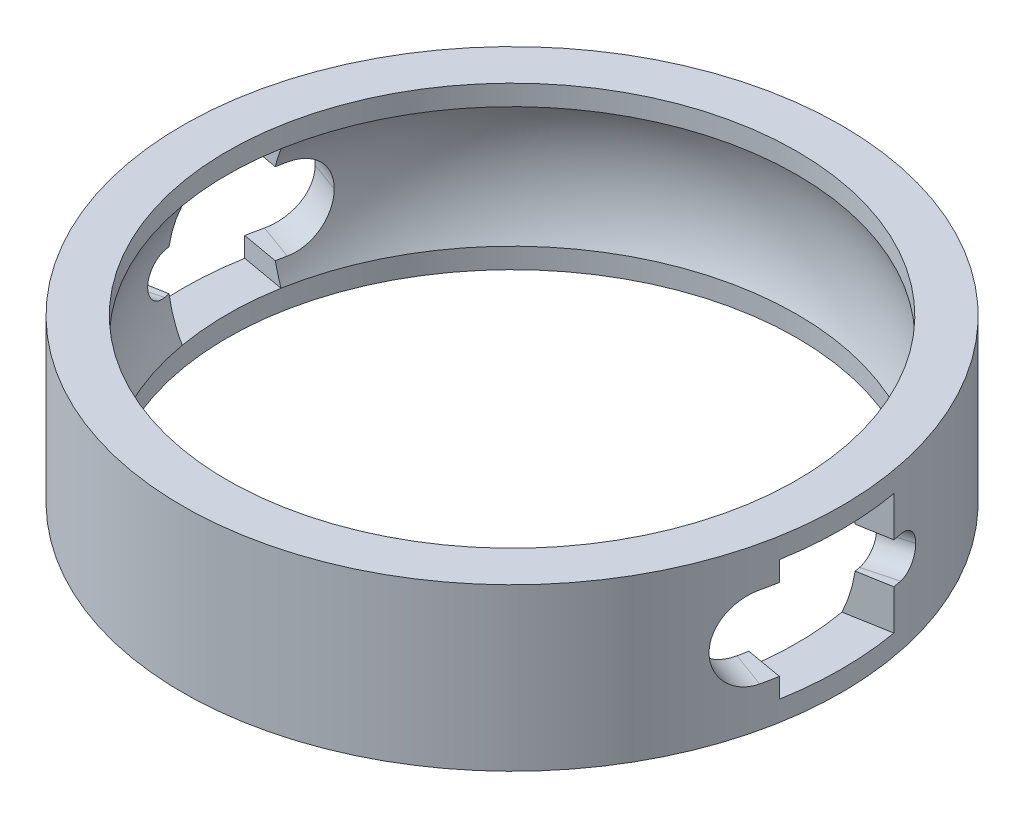
from build123d import *

# Parameters (mm, degrees)
SKETCH1_W          = 2.794
SKETCH1_H          = 10.0838
SKETCH7_W          = 10.16
SKETCH7_H          = 7.5438
CUT_REVOLVE2_ANGLE = 20
SKETCH8_W          = 10.16
SKETCH8_H          = 5.08
CUT_REVOLVE3_ANGLE = 10
SKETCH9_W          = 10.16
SKETCH9_H          = 2.54
CUT_REVOLVE4_ANGLE = 5
CIRPATTERN2_COUNT  = 2
FILLET1_R          = 2.54
FILLET2_R          = 1.27


with BuildPart() as part:
    # Sketch1 → Revolve1 (revolve)
    with BuildSketch(Plane.XY, mode=Mode.PRIVATE) as revolve1_sk:
        with Locations((-19.177, 0)):
            Rectangle(SKETCH1_W, SKETCH1_H)
    revolve(revolve1_sk.sketch.rotate(Axis((0, 0, 0), (0, 1, 0)), 270), axis=Axis((0, 0, 0), (0, 1, 0)))

    # Sketch2 → Cut-Revolve1 (revolve, cut)
    with BuildSketch(Plane.XY, mode=Mode.PRIVATE) as cut_revolve1_sk:
        with BuildLine():
            Line((-17.78, 3.7719), (-15.24, 3.7719))
            Line((-15.24, 3.7719), (-15.24, -3.7719))
            Line((-15.24, -3.7719), (-17.78, -3.7719))
            ThreePointArc((-17.78, -3.7719), (-18.57375, 0), (-17.78, 3.7719))
        make_face()
    revolve(cut_revolve1_sk.sketch.rotate(Axis((0, 0, 0), (0, 1, 0)), 270), axis=Axis((0, 0, 0), (0, 1, 0)), mode=Mode.SUBTRACT)

    # Sketch7 → Cut-Revolve2 (revolve, symmetric, cut)
    with BuildSketch(Plane.XY) as cut_revolve2_sk:
        with Locations((-22.86, 0)):
            Rectangle(SKETCH7_W, SKETCH7_H)
    cut_revolve2 = revolve(axis=Axis((0, 0, 0), (0, 1, 0)), revolution_arc=CUT_REVOLVE2_ANGLE / 2, mode=Mode.SUBTRACT)
    cut_revolve2 = cut_revolve2 + revolve(cut_revolve2_sk.sketch, axis=Axis((0, 0, 0), (0, -1, 0)), revolution_arc=CUT_REVOLVE2_ANGLE / 2, mode=Mode.SUBTRACT)

    # Sketch8 → Cut-Revolve3 (revolve, cut)
    with BuildSketch(Plane(origin=(0, 0, 0), x_dir=(0.9848077530122081, 0, 0.17364817766693072), z_dir=(-0.17364817766693072, 0, 0.9848077530122081))):
        with Locations((-23.302480977, 0)):
            Rectangle(SKETCH8_W, SKETCH8_H)
    cut_revolve3 = revolve(axis=Axis((0, 0, 0), (0, -1, 0)), revolution_arc=CUT_REVOLVE3_ANGLE, mode=Mode.SUBTRACT)

    # Sketch9 → Cut-Revolve4 (revolve, cut)
    with BuildSketch(Plane(origin=(0, 0, 0), x_dir=(-0.9848077530122081, 0, 0.17364817766693075), z_dir=(-0.17364817766693075, 0, -0.9848077530122081))):
        with Locations((23.567180389, 0)):
            Rectangle(SKETCH9_W, SKETCH9_H)
    cut_revolve4 = revolve(axis=Axis((0, 0, 0), (0, 1, 0)), revolution_arc=CUT_REVOLVE4_ANGLE, mode=Mode.SUBTRACT)

    # CirPattern2: Cut-Revolve2, Cut-Revolve3, Cut-Revolve4 ×2 about axis
    cirpattern2_axis = Axis((0, 0, 0), (0, 1, 0))
    add([cut_revolve2.rotate(cirpattern2_axis, i * 360 / CIRPATTERN2_COUNT) for i in range(1, CIRPATTERN2_COUNT)], mode=Mode.SUBTRACT)
    add([cut_revolve3.rotate(cirpattern2_axis, i * 360 / CIRPATTERN2_COUNT) for i in range(1, CIRPATTERN2_COUNT)], mode=Mode.SUBTRACT)
    add([cut_revolve4.rotate(cirpattern2_axis, i * 360 / CIRPATTERN2_COUNT) for i in range(1, CIRPATTERN2_COUNT)], mode=Mode.SUBTRACT)

    # Fillet1
    fillet1_edges = [part.edges().sort_by_distance(p)[0] for p in [
        (18.228383443, 2.54, 6.634588992),
        (18.228383443, -2.54, 6.634588992),
        (-18.228383443, -2.54, -6.634588992),
        (-18.228383443, 2.54, -6.634588992),
    ]]
    fillet(fillet1_edges, radius=FILLET1_R - 0.0001)  # a hair under: the kernel refuses the full size

    # Fillet2
    fillet2_edges = [part.edges().sort_by_distance(p)[0] for p in [
        (-18.865101471, -1.27, 5.054888704),
        (-18.865101471, 1.27, 5.054888704),
        (18.865101471, -1.27, -5.054888704),
        (18.865101471, 1.27, -5.054888704),
    ]]
    fillet(fillet2_edges, radius=FILLET2_R - 0.0001)  # a hair under: the kernel refuses the full size


solid = part.part
